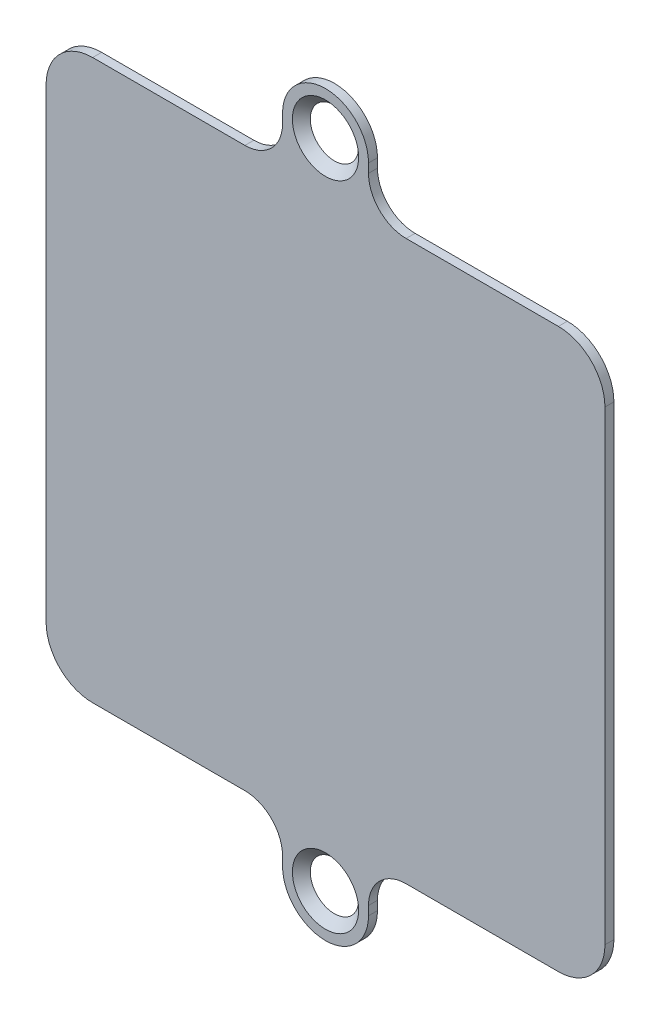
from build123d import *

# Parameters (mm, degrees)
SKETCH_1_R      = 1
EXTRUDE_1_DEPTH = 0.5
CHAMFER_1_SIZE  = 0.85
SCALE_1_SCALE   = 1.08


with BuildPart() as part:
    # Эскиз1 → Бобышка-Вытянуть1 (new body)
    with BuildSketch(Plane.XY):
        with BuildLine():
            Line((-15.6, 13), (-15.6, -13))
            ThreePointArc((-15.6, -13), (-14.838477631, -14.838477631), (-13, -15.6))
            Line((-13, -15.6), (-12.5, -15.6))
            Line((-12.5, -15.6), (-4.5, -15.6))
            ThreePointArc((-4.5, -15.6), (-3.01507576, -16.21507576), (-2.4, -17.7))
            Line((-2.4, -17.7), (-2.4, -18.2))
            ThreePointArc((-2.4, -18.2), (0, -20.6), (2.4, -18.2))
            Line((2.4, -18.2), (2.4, -17.7))
            ThreePointArc((2.4, -17.7), (3.01507576, -16.21507576), (4.5, -15.6))
            Line((4.5, -15.6), (12.5, -15.6))
            Line((12.5, -15.6), (13, -15.6))
            ThreePointArc((13, -15.6), (14.838477631, -14.838477631), (15.6, -13))
            Line((15.6, -13), (15.6, 13))
            ThreePointArc((15.6, 13), (14.838477631, 14.838477631), (13, 15.6))
            Line((13, 15.6), (12.5, 15.6))
            Line((12.5, 15.6), (4.5, 15.6))
            ThreePointArc((4.5, 15.6), (3.01507576, 16.21507576), (2.4, 17.7))
            Line((2.4, 17.7), (2.4, 18.2))
            ThreePointArc((2.4, 18.2), (0, 20.6), (-2.4, 18.2))
            Line((-2.4, 18.2), (-2.4, 17.7))
            ThreePointArc((-2.4, 17.7), (-3.01507576, 16.21507576), (-4.5, 15.6))
            Line((-4.5, 15.6), (-12.5, 15.6))
            Line((-12.5, 15.6), (-13, 15.6))
            ThreePointArc((-13, 15.6), (-14.838477631, 14.838477631), (-15.6, 13))
        make_face()
        with Locations((0, 18.2)):
            Circle(SKETCH_1_R, mode=Mode.SUBTRACT)
        with Locations(Location((0, -18.2, 0), (0, 0, 180))):
            Circle(SKETCH_1_R, mode=Mode.SUBTRACT)
    extrude(amount=EXTRUDE_1_DEPTH)

    # Фаска1
    # the kernel refuses this chamfer: 0.85 mm, written as the material it takes off along each edge
    with BuildSketch(Plane(origin=(0, -18.2, 0.5), x_dir=(-1, 0, 0), z_dir=(0, 1, 0))) as chamfer_1_piece_1:
        Polygon((1 + CHAMFER_1_SIZE, 0), (1, -CHAMFER_1_SIZE), (1, 0), align=None)
    revolve(axis=Axis((0, -18.2, 0.5), (0, 0, 1)), mode=Mode.SUBTRACT)
    with BuildSketch(Plane(origin=(0, 18.2, 0.5), x_dir=(1, 0, 0), z_dir=(0, -1, 0))) as chamfer_1_piece_2:
        Polygon((1 + CHAMFER_1_SIZE, 0), (1, -CHAMFER_1_SIZE), (1, 0), align=None)
    revolve(axis=Axis((0, 18.2, 0.5), (0, 0, 1)), mode=Mode.SUBTRACT)


with BuildPart() as part_1:
    # Масштаб1: scaled about (0, 0, 0.249580392)
    add(part.part.scale(SCALE_1_SCALE).moved(Location((0, 0, -0.019966431))))


solid = part_1.part
